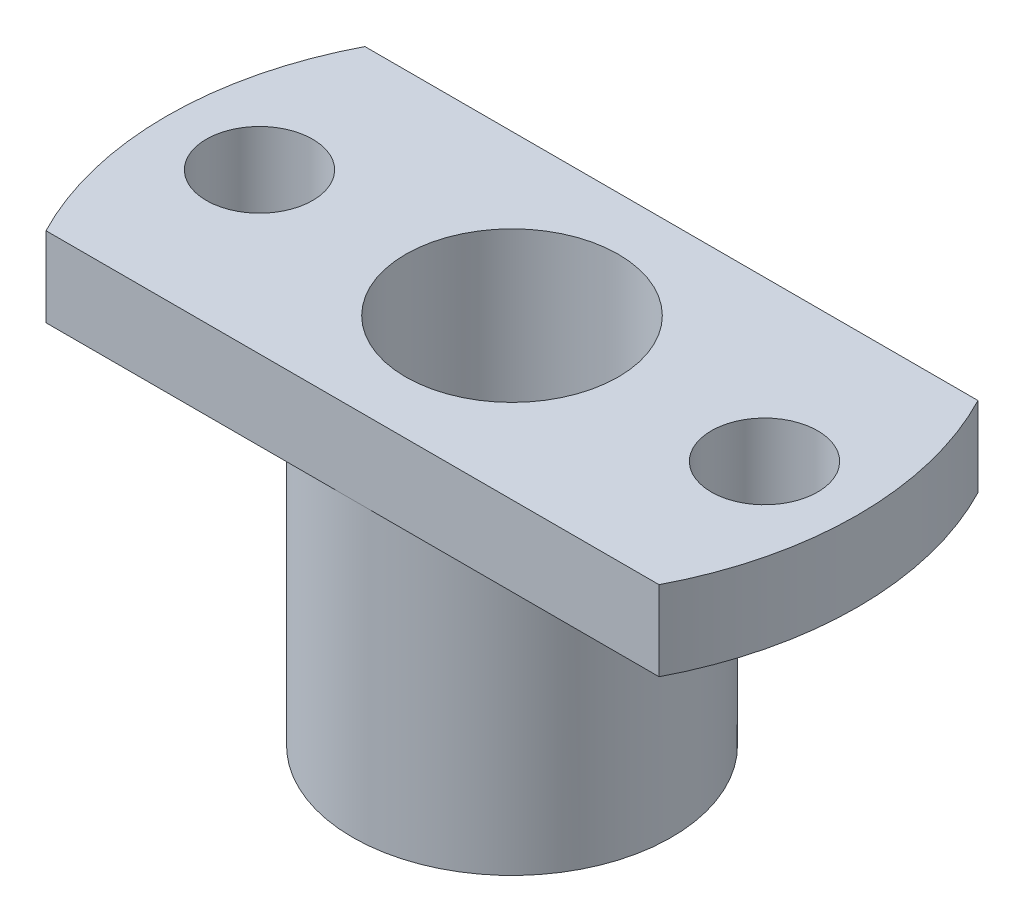
from build123d import *

# Parameters (mm, degrees)
SKETCH1_R           = 3
SKETCH1_R_2         = 2
BOSS_EXTRUDE1_DEPTH = 5.5
BOSS_EXTRUDE2_DEPTH = 1.5
SKETCH3_R           = 2
CUT_EXTRUDE1_DEPTH  = 11.5
SKETCH4_R           = 1
CUT_EXTRUDE2_DEPTH  = 11.5
CHAMFER1_SIZE       = 1


with BuildPart() as part:
    # Sketch1 → Boss-Extrude1 (new body)
    with BuildSketch(Plane(origin=(0, 0, 0), x_dir=(1, 0, 0), z_dir=(0, 1, 0))):
        with Locations(Location((0, 0, 0), (0, 0, 270))):
            Circle(SKETCH1_R)
        with Locations(Location((0, 0, 0), (0, 0, 270))):
            Circle(SKETCH1_R_2, mode=Mode.SUBTRACT)
    extrude(amount=BOSS_EXTRUDE1_DEPTH)

    # Sketch2 → Boss-Extrude2 (add)
    with BuildSketch(Plane(origin=(0, 5.5, 0), x_dir=(1, 0, 0), z_dir=(0, 1, 0))):
        with BuildLine():
            Line((5.766281297, 3), (-5.766281297, 3))
            ThreePointArc((-5.766281297, 3), (-6.5, 0), (-5.766281297, -3))
            Line((-5.766281297, -3), (5.766281297, -3))
            ThreePointArc((5.766281297, -3), (6.5, 0), (5.766281297, 3))
        make_face()
    extrude(amount=BOSS_EXTRUDE2_DEPTH)

    # Sketch3 → Cut-Extrude1 (cut)
    with BuildSketch(Plane.XZ.offset(-5.5)):
        with Locations(Location((0, 0, 0), (0, 0, 90))):
            Circle(SKETCH3_R)
    extrude(amount=-CUT_EXTRUDE1_DEPTH, mode=Mode.SUBTRACT)

    # Sketch4 → Cut-Extrude2 (cut)
    with BuildSketch(Plane(origin=(0, 7, 0), x_dir=(1, 0, 0), z_dir=(0, 1, 0))):
        with Locations(Location((-4.75, 0, 0), (0, 0, 270))):
            Circle(SKETCH4_R)
        with Locations(Location((4.75, 0, 0), (0, 0, 270))):
            Circle(SKETCH4_R)
    extrude(amount=-CUT_EXTRUDE2_DEPTH, mode=Mode.SUBTRACT)

    # Chamfer1
    chamfer1_edges = [part.edges().sort_by_distance(p)[0] for p in [
        (0, 0, -2),
    ]]
    chamfer(chamfer1_edges, length=CHAMFER1_SIZE - 0.0001)  # a hair under: the kernel refuses the full size


solid = part.part
